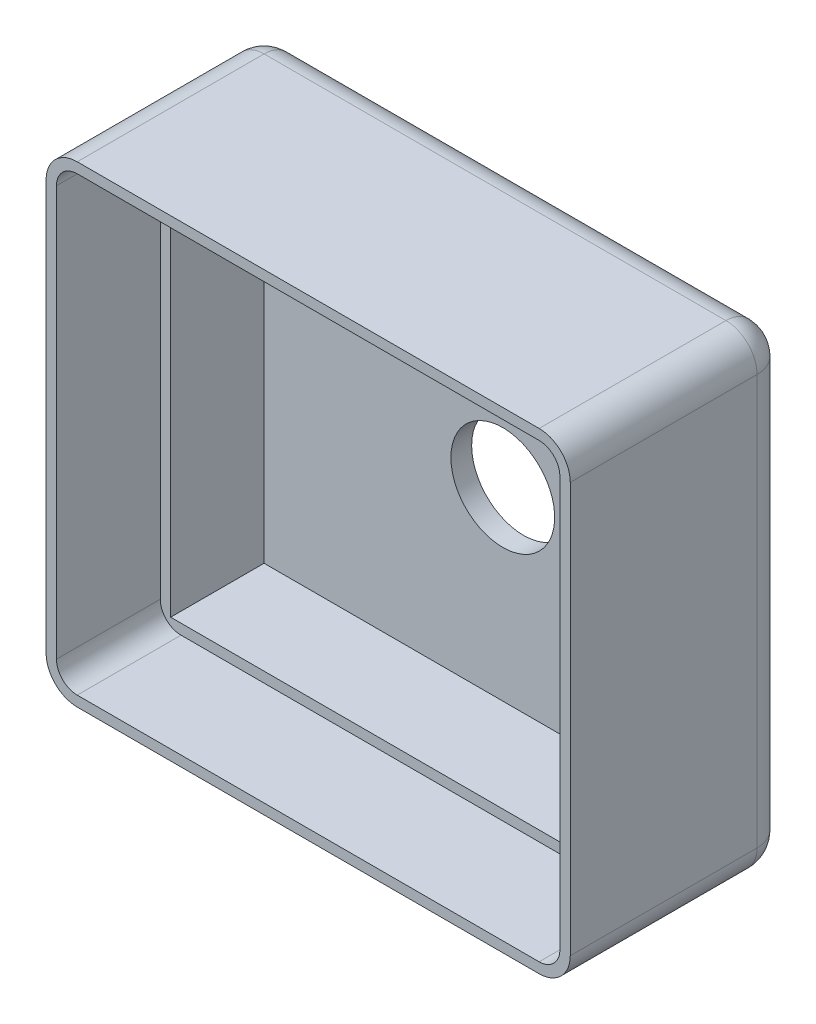
from build123d import *

# Parameters (mm, degrees)
SCHIZZO1_W                   = 50.5
SCHIZZO1_H                   = 45.5
ESTRUSIONE_ESTRUSIONE1_DEPTH = 2
SCHIZZO5_W                   = 2
SCHIZZO5_H                   = 45.5
ESTRUSIONE_ESTRUSIONE2_DEPTH = 9
SCHIZZO6_W                   = 48.5
SCHIZZO6_H                   = 2
ESTRUSIONE_ESTRUSIONE3_DEPTH = 9
SCHIZZO7_W                   = 2
SCHIZZO7_H                   = 43.5
ESTRUSIONE_ESTRUSIONE4_DEPTH = 9
SCHIZZO8_W                   = 46.5
SCHIZZO8_H                   = 2
ESTRUSIONE_ESTRUSIONE5_DEPTH = 9
SCHIZZO9_W                   = 1
SCHIZZO9_H                   = 45.5
ESTRUSIONE_ESTRUSIONE6_DEPTH = 10
SCHIZZO10_W                  = 49.5
SCHIZZO10_H                  = 1
ESTRUSIONE_ESTRUSIONE7_DEPTH = 10
SCHIZZO11_W                  = 1
SCHIZZO11_H                  = 44.5
ESTRUSIONE_ESTRUSIONE8_DEPTH = 10
SCHIZZO12_W                  = 48.5
SCHIZZO12_H                  = 1
ESTRUSIONE_ESTRUSIONE9_DEPTH = 10
RACCORDO1_R                  = 3
SCHIZZO13_R                  = 5
TAGLIO_ESTRUSIONE2_DEPTH     = 2
RACCORDO2_R                  = 2


with BuildPart() as part:
    # Schizzo1 → Estrusione-Estrusione1 (new body)
    with BuildSketch(Plane.XY):
        with Locations((25.25, 22.75)):
            Rectangle(SCHIZZO1_W, SCHIZZO1_H)
    extrude(amount=ESTRUSIONE_ESTRUSIONE1_DEPTH)

    # Schizzo5 → Estrusione-Estrusione2 (add)
    with BuildSketch(Plane.XY.offset(2)):
        with Locations((49.5, 22.75)):
            Rectangle(SCHIZZO5_W, SCHIZZO5_H)
    extrude(amount=ESTRUSIONE_ESTRUSIONE2_DEPTH)

    # Schizzo6 → Estrusione-Estrusione3 (add)
    with BuildSketch(Plane.XY.offset(2)):
        with Locations((24.25, 44.5)):
            Rectangle(SCHIZZO6_W, SCHIZZO6_H)
    extrude(amount=ESTRUSIONE_ESTRUSIONE3_DEPTH)

    # Schizzo7 → Estrusione-Estrusione4 (add)
    with BuildSketch(Plane.XY.offset(2)):
        with Locations((1, 21.75)):
            Rectangle(SCHIZZO7_W, SCHIZZO7_H)
    extrude(amount=ESTRUSIONE_ESTRUSIONE4_DEPTH)

    # Schizzo8 → Estrusione-Estrusione5 (add)
    with BuildSketch(Plane.XY.offset(2)):
        with Locations((25.25, 1)):
            Rectangle(SCHIZZO8_W, SCHIZZO8_H)
    extrude(amount=ESTRUSIONE_ESTRUSIONE5_DEPTH)

    # Schizzo9 → Estrusione-Estrusione6 (add)
    with BuildSketch(Plane.XY.offset(11)):
        with Locations((50, 22.75)):
            Rectangle(SCHIZZO9_W, SCHIZZO9_H)
    extrude(amount=ESTRUSIONE_ESTRUSIONE6_DEPTH)

    # Schizzo10 → Estrusione-Estrusione7 (add)
    with BuildSketch(Plane.XY.offset(11)):
        with Locations((24.75, 0.5)):
            Rectangle(SCHIZZO10_W, SCHIZZO10_H)
    extrude(amount=ESTRUSIONE_ESTRUSIONE7_DEPTH)

    # Schizzo11 → Estrusione-Estrusione8 (add)
    with BuildSketch(Plane.XY.offset(11)):
        with Locations((0.5, 23.25)):
            Rectangle(SCHIZZO11_W, SCHIZZO11_H)
    extrude(amount=ESTRUSIONE_ESTRUSIONE8_DEPTH)

    # Schizzo12 → Estrusione-Estrusione9 (add)
    with BuildSketch(Plane.XY.offset(11)):
        with Locations((25.25, 45)):
            Rectangle(SCHIZZO12_W, SCHIZZO12_H)
    extrude(amount=ESTRUSIONE_ESTRUSIONE9_DEPTH)

    # Raccordo1
    raccordo1_edges = [part.edges().sort_by_distance(p)[0] for p in [
        (25.25, 45.5, 0),
        (0, 45.5, 10.5),
        (50.5, 45.5, 10.5),
        (50.5, 0, 10.5),
        (50.5, 22.75, 0),
        (25.25, 0, 0),
        (0, 0, 10.5),
        (0, 22.75, 0),
    ]]
    fillet(raccordo1_edges, radius=RACCORDO1_R)

    # Schizzo13 → Taglio-Estrusione2 (cut)
    with BuildSketch(Plane(origin=(0, 0, 0), x_dir=(-1, 0, 0), z_dir=(0, 0, -1))):
        with Locations((-25, 19.824102988)):
            Circle(SCHIZZO13_R)
    extrude(amount=-TAGLIO_ESTRUSIONE2_DEPTH, mode=Mode.SUBTRACT)

    # Raccordo2
    raccordo2_edges = [part.edges().sort_by_distance(p)[0] for p in [
        (49.5, 44.5, 16),
        (49.5, 1, 16),
        (1, 1, 16),
        (1, 44.5, 16),
    ]]
    fillet(raccordo2_edges, radius=RACCORDO2_R)


solid = part.part
